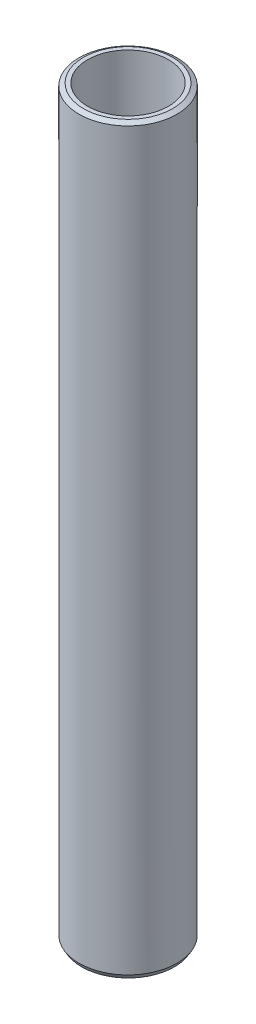
from build123d import *
from OCP.BRepFilletAPI import BRepFilletAPI_MakeChamfer

# Parameters (mm, degrees)
SKETCH1_R           = 25
BOSS_EXTRUDE1_DEPTH = 378.721173541
SKETCH2_R           = 20.635957913
CUT_EXTRUDE1_DEPTH  = 381.367884145
CHAMFER1_SIZE       = 1.317239038
CHAMFER1_SIZE2      = 2.28152494


with BuildPart() as part:
    # Sketch1 → Boss-Extrude1 (new body)
    with BuildSketch(Plane(origin=(0, 0, 0), x_dir=(1, 0, 0), z_dir=(0, 1, 0))):
        Circle(SKETCH1_R)
    extrude(amount=BOSS_EXTRUDE1_DEPTH)

    # Sketch2 → Cut-Extrude1 (cut, through all)
    with BuildSketch(Plane(origin=(0, 0, 0), x_dir=(1, 0, 0), z_dir=(0, 1, 0))):
        Circle(SKETCH2_R)
    extrude(amount=CUT_EXTRUDE1_DEPTH, mode=Mode.SUBTRACT)

    # Chamfer1: one chamfer whose edges measure the first distance from different faces: ONE call of the kernel's chamfer builder (chamfer() names one face for all edges)
    chamfer1_edges_1 = [part.edges().sort_by_distance(p)[0] for p in [
        (-25, 378.721173541, 0),
    ]]
    chamfer1_side_1 = [part.faces().sort_by_distance(p)[0] for p in [
        (-25, 189.360586771, 0),
    ]]
    chamfer1_edges_2 = [part.edges().sort_by_distance(p)[0] for p in [
        (-25, 0, 0),
    ]]
    chamfer1_side_2 = [part.faces().sort_by_distance(p)[0] for p in [
        (-24.292893219, 0, 0),
    ]]
    chamfer1 = BRepFilletAPI_MakeChamfer(part.part.solid().wrapped)
    for e in chamfer1_edges_1:
        chamfer1.Add(CHAMFER1_SIZE, CHAMFER1_SIZE2, e.wrapped, chamfer1_side_1[0].wrapped)  # the first distance lies on this face
    for e in chamfer1_edges_2:
        chamfer1.Add(CHAMFER1_SIZE, CHAMFER1_SIZE2, e.wrapped, chamfer1_side_2[0].wrapped)  # the first distance lies on this face
    add(Compound.cast(chamfer1.Shape()), mode=Mode.REPLACE)


solid = part.part
